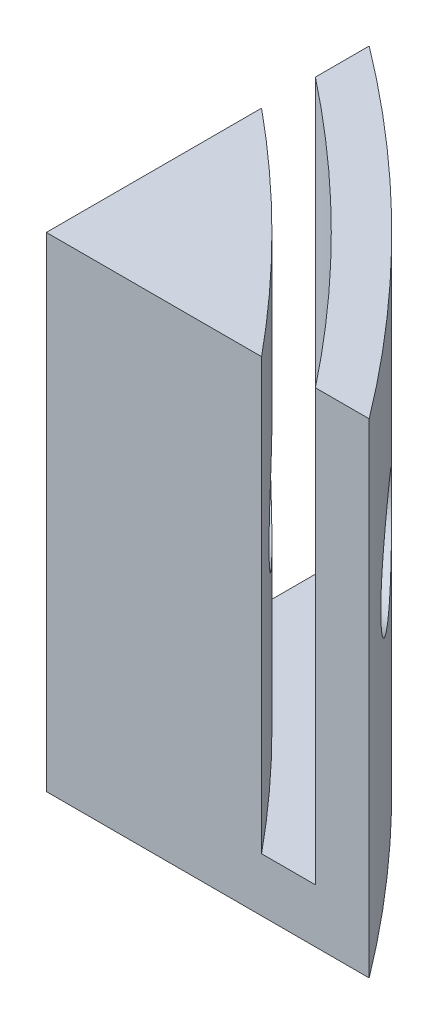
from build123d import *

# Parameters (mm, degrees)
BOSS_EXTRUDE1_DEPTH = 28.575
CUT_EXTRUDE1_DEPTH  = 25.4
SKETCH4_R           = 3.175
CUT_EXTRUDE2_DEPTH  = 40.272581084


with BuildPart() as part:
    # Sketch2 → Boss-Extrude1 (new body)
    with BuildSketch(Plane(origin=(0, 0, 0), x_dir=(1, 0, 0), z_dir=(0, 1, 0))):
        with BuildLine():
            Line((0, 0), (19.05, 0))
            ThreePointArc((19.05, 0), (10.190713972, 10.190713972), (0, 19.05))
            Line((0, 19.05), (0, 0))
        make_face()
    extrude(amount=BOSS_EXTRUDE1_DEPTH)

    # Sketch3 → Cut-Extrude1 (cut)
    with BuildSketch(Plane(origin=(0, 28.575, 0), x_dir=(1, 0, 0), z_dir=(0, 1, 0))):
        with BuildLine():
            Line((12.7, 0), (15.875, 0))
            ThreePointArc((15.875, 0), (8.406857083, 8.406857083), (0, 15.875))
            Line((0, 15.875), (0, 12.7))
            ThreePointArc((0, 12.7), (6.655118301, 6.655118301), (12.7, 0))
        make_face()
    extrude(amount=-CUT_EXTRUDE1_DEPTH, mode=Mode.SUBTRACT)

    # Sketch4 → Cut-Extrude2 (cut, through all)
    with BuildSketch(Plane.ZY):
        with Locations((-6.394452699, 15.875)):
            Circle(SKETCH4_R)
    extrude(amount=-CUT_EXTRUDE2_DEPTH, mode=Mode.SUBTRACT)


solid = part.part
